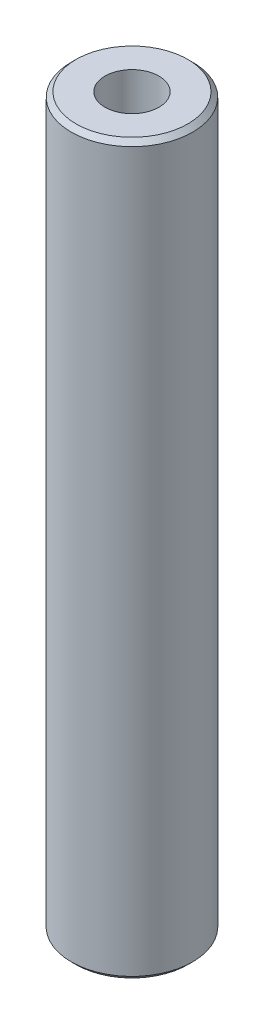
from build123d import *

# Parameters (mm, degrees)
SKETCH1_R           = 50
BOSS_EXTRUDE1_DEPTH = 600
SKETCH2_R           = 22.261616368
CUT_EXTRUDE1_DEPTH  = 605.15229868
CHAMFER1_SIZE       = 3.934220833


with BuildPart() as part:
    # Sketch1 → Boss-Extrude1 (new body)
    with BuildSketch(Plane(origin=(0, 0, 0), x_dir=(1, 0, 0), z_dir=(0, 1, 0))):
        Circle(SKETCH1_R)
    extrude(amount=BOSS_EXTRUDE1_DEPTH)

    # Sketch2 → Cut-Extrude1 (cut, through all)
    with BuildSketch(Plane(origin=(0, 0, 0), x_dir=(1, 0, 0), z_dir=(0, 1, 0))):
        Circle(SKETCH2_R)
    extrude(amount=CUT_EXTRUDE1_DEPTH, mode=Mode.SUBTRACT)

    # Chamfer1
    chamfer1_edges = [part.edges().sort_by_distance(p)[0] for p in [
        (-50, 600, 0),
        (-50, 0, 0),
    ]]
    chamfer(chamfer1_edges, length=CHAMFER1_SIZE)


solid = part.part
